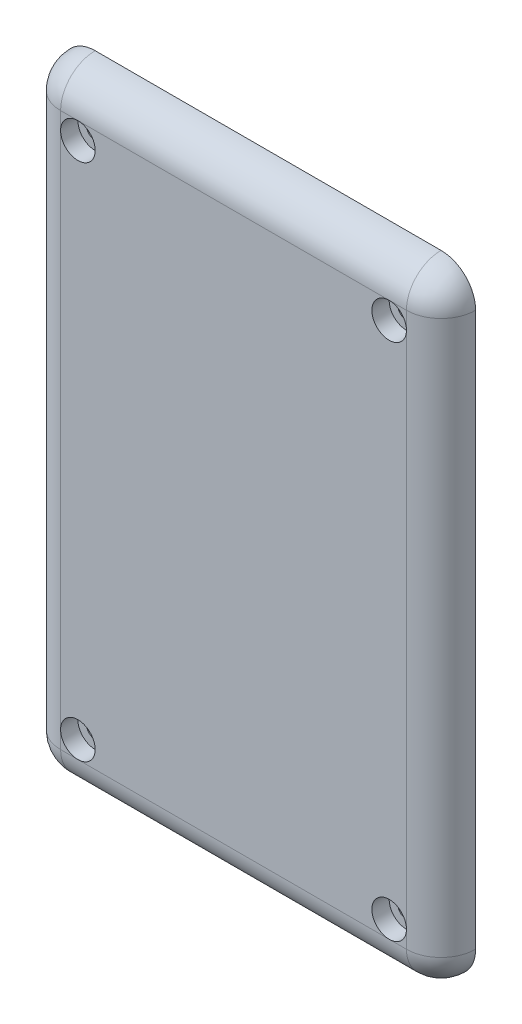
from build123d import *

# Parameters (mm, degrees)
SKETCH_1_W          = 24
SKETCH_1_H          = 36
EXTRUDE_1_DEPTH     = 2
FILLET_1_R          = 2
SKETCH_4_R          = 2.05
CUT_EXTRUDE_1_DEPTH = 1
SKETCH_9_R          = 1
CUT_EXTRUDE_3_DEPTH = 1
CUT_EXTRUDE_4_REACH = 146.484
SKETCH_10_R         = 0.5


with BuildPart() as part:
    # 草图1 → 凸台-拉伸1 (new body)
    with BuildSketch(Plane.XY):
        with Locations((-109.790086771, 59.72858385)):
            Rectangle(SKETCH_1_W, SKETCH_1_H)
    extrude(amount=EXTRUDE_1_DEPTH)

    # 圆角1
    fillet_1_edges = [part.edges().sort_by_distance(p)[0] for p in [
        (-121.790086771, 59.72858385, 2),
        (-109.790086771, 41.72858385, 2),
        (-97.790086771, 59.72858385, 2),
        (-97.790086771, 41.72858385, 1),
        (-121.790086771, 41.72858385, 1),
        (-121.790086771, 77.72858385, 1),
        (-97.790086771, 77.72858385, 1),
        (-109.790086771, 77.72858385, 2),
    ]]
    fillet(fillet_1_edges, radius=FILLET_1_R - 0.0001)  # a hair under: the kernel refuses the full size

    # 草图4 → 切除-拉伸1 (cut)
    with BuildSketch(Plane(origin=(0, 0, 0), x_dir=(-1, 0, 0), z_dir=(0, 0, -1))):
        with Locations((117.950086771, 65.97858385)):
            Circle(SKETCH_4_R)
    extrude(amount=-CUT_EXTRUDE_1_DEPTH, mode=Mode.SUBTRACT)

    # 草图9 → 切除-拉伸3 (cut)
    with BuildSketch(Plane.XY.offset(2)):
        with Locations((-100.790086771, 74.72858385)):
            Circle(SKETCH_9_R)
        with Locations((-100.790086771, 44.72858385)):
            Circle(SKETCH_9_R)
        with Locations((-118.790086771, 44.72858385)):
            Circle(SKETCH_9_R)
        with Locations((-118.790086771, 74.72858385)):
            Circle(SKETCH_9_R)
    extrude(amount=-CUT_EXTRUDE_3_DEPTH, mode=Mode.SUBTRACT)

    # 草图10 → 切除-拉伸4 (cut, up to next)
    with BuildSketch(Plane.XY.offset(1), mode=Mode.PRIVATE) as cut_extrude_4_sk1:
        with Locations((-118.790086771, 44.72858385)):
            Circle(SKETCH_10_R)
    cut_extrude_4_tool1 = extrude(cut_extrude_4_sk1.sketch, amount=-CUT_EXTRUDE_4_REACH, mode=Mode.PRIVATE) & part.part
    # 草图10 → 切除-拉伸4 (cut, up to next)
    with BuildSketch(Plane.XY.offset(1), mode=Mode.PRIVATE) as cut_extrude_4_sk2:
        with Locations((-100.790086771, 44.72858385)):
            Circle(SKETCH_10_R)
    cut_extrude_4_tool2 = extrude(cut_extrude_4_sk2.sketch, amount=-CUT_EXTRUDE_4_REACH, mode=Mode.PRIVATE) & part.part
    # 草图10 → 切除-拉伸4 (cut, up to next)
    with BuildSketch(Plane.XY.offset(1), mode=Mode.PRIVATE) as cut_extrude_4_sk3:
        with Locations((-100.790086771, 74.72858385)):
            Circle(SKETCH_10_R)
    cut_extrude_4_tool3 = extrude(cut_extrude_4_sk3.sketch, amount=-CUT_EXTRUDE_4_REACH, mode=Mode.PRIVATE) & part.part
    # 草图10 → 切除-拉伸4 (cut, up to next)
    with BuildSketch(Plane.XY.offset(1), mode=Mode.PRIVATE) as cut_extrude_4_sk4:
        with Locations((-118.790086771, 74.72858385)):
            Circle(SKETCH_10_R)
    cut_extrude_4_tool4 = extrude(cut_extrude_4_sk4.sketch, amount=-CUT_EXTRUDE_4_REACH, mode=Mode.PRIVATE) & part.part
    add(cut_extrude_4_tool1.solids().sort_by_distance((-118.790087, 44.728584, 1))[0], mode=Mode.SUBTRACT)
    add(cut_extrude_4_tool2.solids().sort_by_distance((-100.790087, 44.728584, 1))[0], mode=Mode.SUBTRACT)
    add(cut_extrude_4_tool3.solids().sort_by_distance((-100.790087, 74.728584, 1))[0], mode=Mode.SUBTRACT)
    add(cut_extrude_4_tool4.solids().sort_by_distance((-118.790087, 74.728584, 1))[0], mode=Mode.SUBTRACT)


solid = part.part
